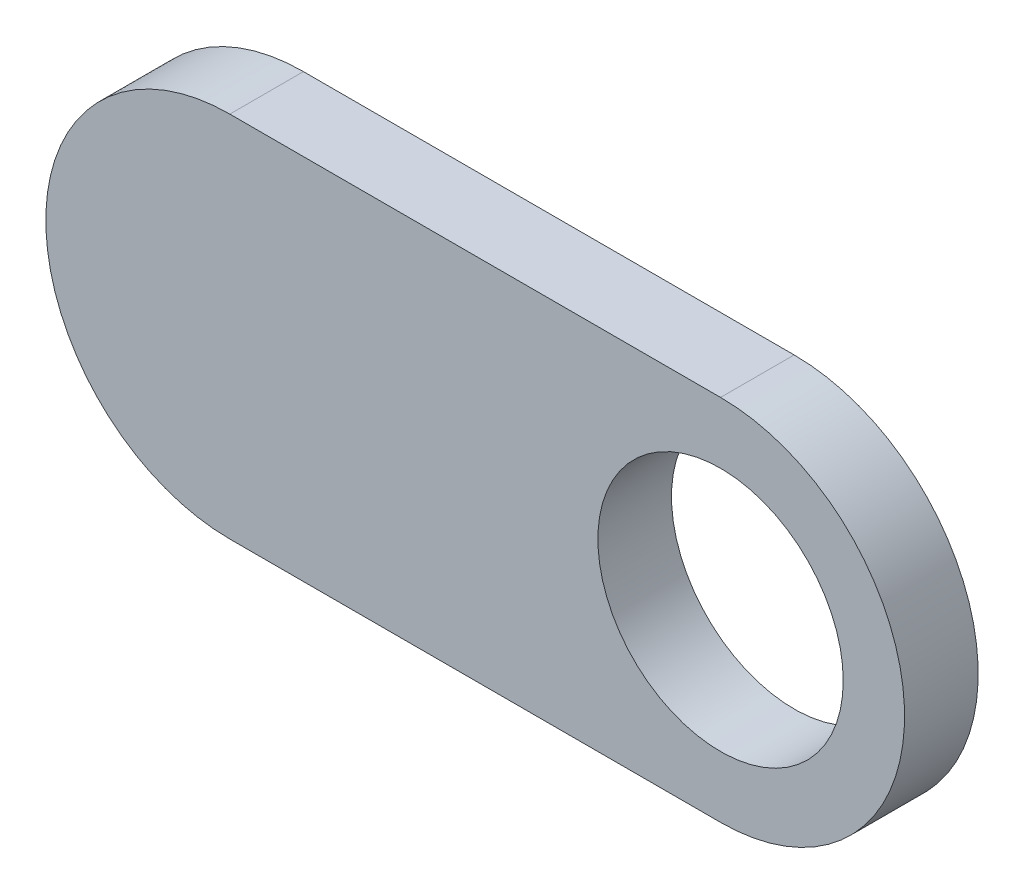
from build123d import *

# Parameters (mm, degrees)
SKETCH1_R          = 5
BASE_FLANGE1_DEPTH = 3


# Sheet-metal steps are written as plain solids
with BuildPart() as part:
    # Sketch1 → Base-Flange1 (new body)
    with BuildSketch(Plane.XY):
        with BuildLine():
            Line((-10, 7.5), (10, 7.5))
            ThreePointArc((10, 7.5), (17.5, 0), (10, -7.5))
            Line((10, -7.5), (-10, -7.5))
            ThreePointArc((-10, -7.5), (-17.5, 0), (-10, 7.5))
        make_face()
        with Locations((10, 0)):
            Circle(SKETCH1_R, mode=Mode.SUBTRACT)
    extrude(amount=-BASE_FLANGE1_DEPTH)


solid = part.part
